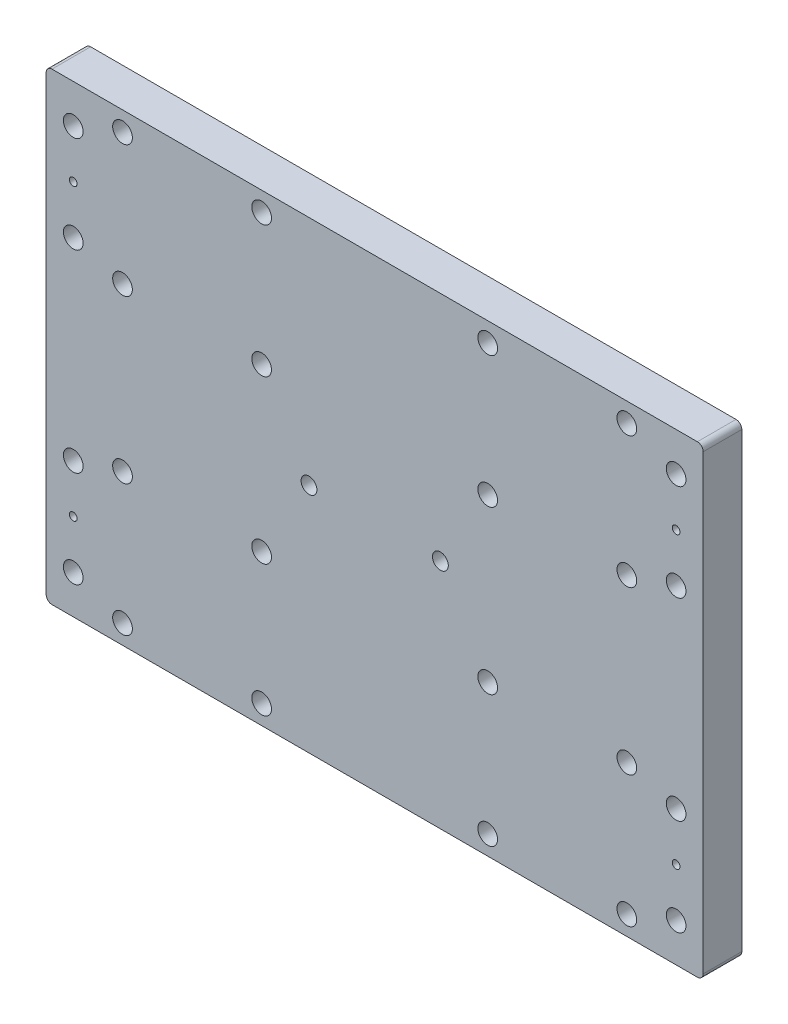
from build123d import *

# Parameters (mm, degrees)
SKETCH1_W           = 170
SKETCH1_H           = 120
BOSS_EXTRUDE1_DEPTH = 5
SKETCH2_R           = 2.55
CUT_EXTRUDE1_DEPTH  = 105.522724802
SKETCH4_R           = 2.05
CUT_EXTRUDE3_DEPTH  = 105.522724802
FILLET1_R           = 1.5
SKETCH6_R           = 2.55
SKETCH6_R_2         = 1
CUT_EXTRUDE5_DEPTH  = 105.522724802


with BuildPart() as part:
    # Sketch1 → Boss-Extrude1 (new, symmetric)
    with BuildSketch(Plane.XY):
        Rectangle(SKETCH1_W, SKETCH1_H)
    extrude(amount=BOSS_EXTRUDE1_DEPTH, both=True)

    # Sketch2 → Cut-Extrude1 (cut, through all)
    with BuildSketch(Plane.XY.offset(5)):
        with Locations((-65.25, 55)):
            Circle(SKETCH2_R)
        with Locations((-29.25, 55)):
            Circle(SKETCH2_R)
        with Locations((-29.25, 21)):
            Circle(SKETCH2_R)
        with Locations((-65.25, 21)):
            Circle(SKETCH2_R)
        with Locations((65.25, 55)):
            Circle(SKETCH2_R)
        with Locations((65.25, 21)):
            Circle(SKETCH2_R)
        with Locations((29.25, 21)):
            Circle(SKETCH2_R)
        with Locations((29.25, 55)):
            Circle(SKETCH2_R)
        with Locations((-65.25, -21)):
            Circle(SKETCH2_R)
        with Locations((-29.25, -21)):
            Circle(SKETCH2_R)
        with Locations((-29.25, -55)):
            Circle(SKETCH2_R)
        with Locations((-65.25, -55)):
            Circle(SKETCH2_R)
        with Locations((29.25, -21)):
            Circle(SKETCH2_R)
        with Locations((65.25, -21)):
            Circle(SKETCH2_R)
        with Locations((65.25, -55)):
            Circle(SKETCH2_R)
        with Locations((29.25, -55)):
            Circle(SKETCH2_R)
    extrude(amount=-CUT_EXTRUDE1_DEPTH, mode=Mode.SUBTRACT)

    # Sketch4 → Cut-Extrude3 (cut, through all)
    with BuildSketch(Plane.XY.offset(5)):
        with Locations((-17, 0)):
            Circle(SKETCH4_R)
        with Locations((17, 0)):
            Circle(SKETCH4_R)
    extrude(amount=-CUT_EXTRUDE3_DEPTH, mode=Mode.SUBTRACT)

    # Fillet1
    fillet1_edges = [part.edges().sort_by_distance(p)[0] for p in [
        (-85, -60, 0),
        (85, -60, 0),
        (85, 60, 0),
        (-85, 60, 0),
    ]]
    fillet(fillet1_edges, radius=FILLET1_R)

    # Sketch6 → Cut-Extrude5 (cut, through all)
    with BuildSketch(Plane.XY.offset(5)):
        with Locations((-78, 50)):
            Circle(SKETCH6_R)
        with Locations((-78, 37.5)):
            Circle(SKETCH6_R_2)
        with Locations((-78, 25)):
            Circle(SKETCH6_R)
        with Locations((-78, -25)):
            Circle(SKETCH6_R)
        with Locations((-78, -37.5)):
            Circle(SKETCH6_R_2)
        with Locations((-78, -50)):
            Circle(SKETCH6_R)
    cut_extrude5 = extrude(amount=-CUT_EXTRUDE5_DEPTH, mode=Mode.SUBTRACT)

    # Mirror1: Cut-Extrude5 across plane
    add(cut_extrude5.mirror(Plane(origin=(0, 0, 0), x_dir=(0, 0, 1), z_dir=(1, 0, 0))), mode=Mode.SUBTRACT)


solid = part.part
